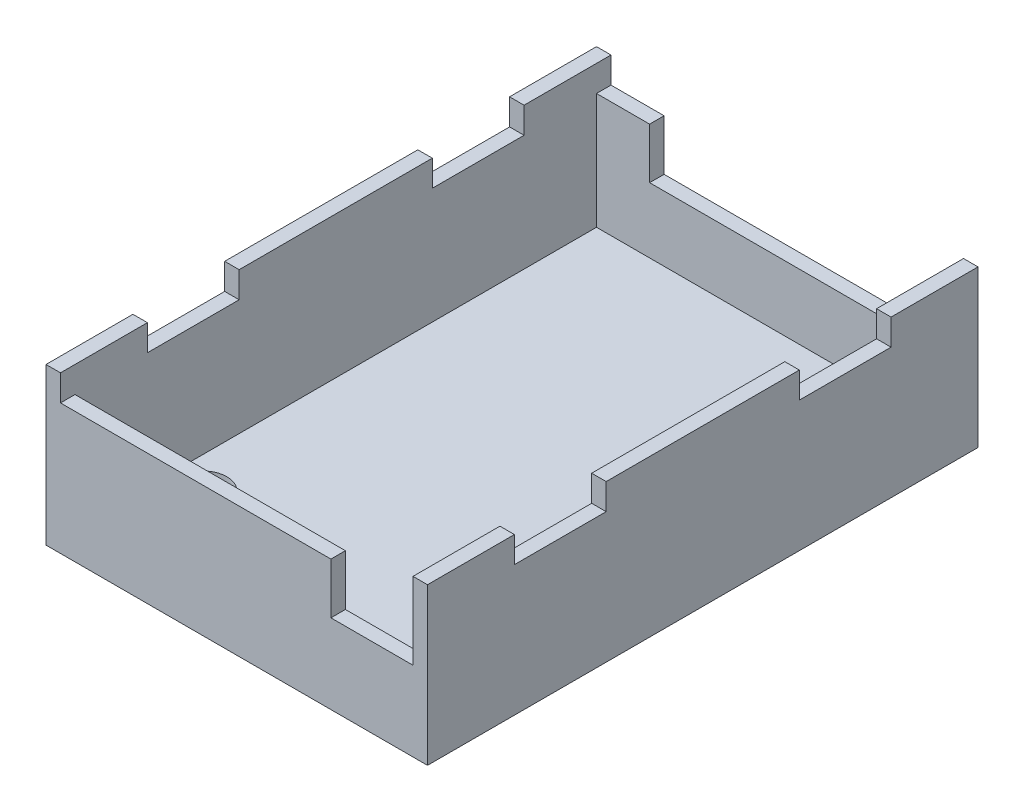
from build123d import *

# Parameters (mm, degrees)
SKETCH1_W           = 39.5
SKETCH1_H           = 57
BOSS_EXTRUDE1_DEPTH = 1.5
SKETCH3_W           = 39.5
SKETCH3_H           = 57
SKETCH3_W_2         = 36.5
SKETCH3_H_2         = 54
BOSS_EXTRUDE2_DEPTH = 12
SKETCH6_W           = 8.5
SKETCH6_H           = 6
CUT_EXTRUDE2_DEPTH  = 11.2
SKETCH7_W           = 29.5
SKETCH7_H           = 5.98
CUT_EXTRUDE3_DEPTH  = 3.3
SKETCH10_W          = 1.5
SKETCH10_H          = 9
SKETCH10_H_2        = 20
BOSS_EXTRUDE4_DEPTH = 2.7
SKETCH11_W          = 7
SKETCH11_H          = 10
CUT_EXTRUDE4_DEPTH  = 7
SKETCH12_R          = 2.5
CUT_EXTRUDE5_DEPTH  = 7


with BuildPart() as part:
    # Sketch1 → Boss-Extrude1 (new body)
    with BuildSketch(Plane(origin=(0, 0, 0), x_dir=(1, 0, 0), z_dir=(0, 1, 0))):
        with Locations((19.75, 28.5)):
            Rectangle(SKETCH1_W, SKETCH1_H)
    extrude(amount=BOSS_EXTRUDE1_DEPTH)

    # Sketch3 → Boss-Extrude2 (add)
    with BuildSketch(Plane(origin=(0, 1.5, 0), x_dir=(1, 0, 0), z_dir=(0, 1, 0))):
        with Locations((19.75, 28.5)):
            Rectangle(SKETCH3_W, SKETCH3_H)
        with Locations((19.75, 28.5)):
            Rectangle(SKETCH3_W_2, SKETCH3_H_2, mode=Mode.SUBTRACT)
    extrude(amount=BOSS_EXTRUDE2_DEPTH)

    # Sketch6 → Cut-Extrude2 (cut)
    with BuildSketch(Plane.XY):
        with Locations((33.75, 11.23)):
            Rectangle(SKETCH6_W, SKETCH6_H)
    extrude(amount=-CUT_EXTRUDE2_DEPTH, mode=Mode.SUBTRACT)

    # Sketch7 → Cut-Extrude3 (cut)
    with BuildSketch(Plane(origin=(0, 0, -57), x_dir=(-1, 0, 0), z_dir=(0, 0, -1))):
        with Locations((-21.75, 11.24)):
            Rectangle(SKETCH7_W, SKETCH7_H)
    extrude(amount=-CUT_EXTRUDE3_DEPTH, mode=Mode.SUBTRACT)

    # Sketch10 → Boss-Extrude4 (add)
    with BuildSketch(Plane(origin=(0, 13.5, 0), x_dir=(1, 0, 0), z_dir=(0, 1, 0))):
        with Locations((0.75, 52.5)):
            Rectangle(SKETCH10_W, SKETCH10_H)
        with Locations((0.75, 28.5)):
            Rectangle(SKETCH10_W, SKETCH10_H_2)
        with Locations((0.75, 4.5)):
            Rectangle(SKETCH10_W, SKETCH10_H)
        with Locations((38.75, 52.5)):
            Rectangle(SKETCH10_W, SKETCH10_H)
        with Locations((38.75, 28.5)):
            Rectangle(SKETCH10_W, SKETCH10_H_2)
        with Locations((38.75, 4.5)):
            Rectangle(SKETCH10_W, SKETCH10_H)
    extrude(amount=BOSS_EXTRUDE4_DEPTH)

    # Sketch11 → Cut-Extrude4 (cut)
    with BuildSketch(Plane(origin=(0, 1.5, 0), x_dir=(1, 0, 0), z_dir=(0, 1, 0))):
        with Locations((33.5, 46.5)):
            Rectangle(SKETCH11_W, SKETCH11_H)
    extrude(amount=-CUT_EXTRUDE4_DEPTH, mode=Mode.SUBTRACT)

    # Sketch12 → Cut-Extrude5 (cut)
    with BuildSketch(Plane(origin=(0, 1.5, 0), x_dir=(1, 0, 0), z_dir=(0, 1, 0))):
        with Locations((4.729026631, 11.5)):
            Circle(SKETCH12_R)
    extrude(amount=-CUT_EXTRUDE5_DEPTH, mode=Mode.SUBTRACT)


solid = part.part
